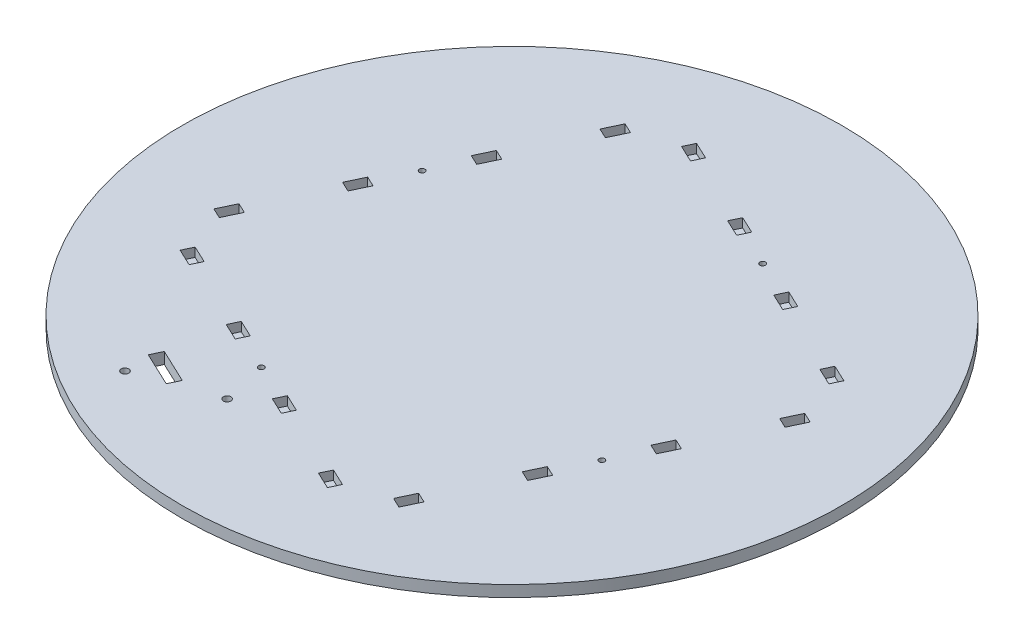
from build123d import *

# Parameters (mm, degrees)
SKETCH1_R           = 175
BOSS_EXTRUDE1_DEPTH = 6
CUT_EXTRUDE1_DEPTH  = 4.75
SKETCH4_R           = 2
CUT_EXTRUDE2_DEPTH  = 248.560093715
SKETCH5_R           = 1.5
CUT_EXTRUDE3_DEPTH  = 248.560093715


with BuildPart() as part:
    # Sketch1 → Boss-Extrude1 (new body)
    with BuildSketch(Plane(origin=(0, 0, 0), x_dir=(1, 0, 0), z_dir=(0, 1, 0))):
        Circle(SKETCH1_R)
    extrude(amount=BOSS_EXTRUDE1_DEPTH)

    # Sketch2 → Cut-Extrude1 (cut)
    with BuildSketch(Plane(origin=(0, 6, 0), x_dir=(1, 0, 0), z_dir=(0, 1, 0))):
        Polygon((32.707843252, -122.732216593), (23.666085268, -118.460611209), (21.103122038, -123.885666), (30.144880022, -128.157271383), align=None)
        Polygon((-13.706514401, -100.804642291), (-22.748272385, -96.533036908), (-25.311235615, -101.958091698), (-16.269477631, -106.229697082), align=None)
        Polygon((-106.535229707, -56.949493687), (-115.576987692, -52.677888304), (-118.139950922, -58.102943094), (-109.098192937, -62.374548478), align=None)
        Polygon((-100.804642291, 13.706514401), (-96.533036908, 22.748272385), (-101.958091698, 25.311235615), (-106.229697082, 16.269477631), align=None)
        Polygon((-122.732216593, -32.707843252), (-118.460611209, -23.666085268), (-123.885666, -21.103122038), (-128.157271383, -30.144880022), align=None)
        Polygon((106.535229707, 56.949493687), (115.576987692, 52.677888304), (118.139950922, 58.102943094), (109.098192937, 62.374548478), align=None)
        Polygon((-56.949493687, 106.535229707), (-52.677888304, 115.576987692), (-58.102943094, 118.139950922), (-62.374548478, 109.098192937), align=None)
        Polygon((60.120872054, 78.877067989), (69.162630038, 74.605462606), (71.725593269, 80.030517396), (62.683835284, 84.30212278), align=None)
        Polygon((13.706514401, 100.804642291), (22.748272385, 96.533036908), (25.311235615, 101.958091698), (16.269477631, 106.229697082), align=None)
        Polygon((-32.707843252, 122.732216593), (-23.666085268, 118.460611209), (-21.103122038, 123.885666), (-30.144880022, 128.157271383), align=None)
        Polygon((-78.877067989, 60.120872054), (-74.605462606, 69.162630038), (-80.030517396, 71.725593269), (-84.30212278, 62.683835284), align=None)
        Polygon((-60.120872054, -78.877067989), (-69.162630038, -74.605462606), (-71.725593269, -80.030517396), (-62.683835284, -84.30212278), align=None)
        Polygon((122.732216593, 32.707843252), (118.460611209, 23.666085268), (123.885666, 21.103122038), (128.157271383, 30.144880022), align=None)
        Polygon((100.804642291, -13.706514401), (96.533036908, -22.748272385), (101.958091698, -25.311235615), (106.229697082, -16.269477631), align=None)
        Polygon((78.877067989, -60.120872054), (74.605462606, -69.162630038), (80.030517396, -71.725593269), (84.30212278, -62.683835284), align=None)
        Polygon((56.949493687, -106.535229707), (52.677888304, -115.576987692), (58.102943094, -118.139950922), (62.374548478, -109.098192937), align=None)
    extrude(amount=-CUT_EXTRUDE1_DEPTH, mode=Mode.SUBTRACT)

    # Sketch4 → Cut-Extrude2 (cut, through all)
    with BuildSketch(Plane(origin=(0, 6, 0), x_dir=(1, 0, 0), z_dir=(0, 1, 0))):
        with Locations((-77.20955719, -128.314785892)):
            Circle(SKETCH4_R)
        with Locations((-37.269467087, -114.004328089)):
            Circle(SKETCH4_R)
        Polygon((-57.680950013, -117.411873359), (-75.764465982, -108.868662592), (-78.498293427, -114.655387702), (-60.414777458, -123.198598469), align=None)
    extrude(amount=-CUT_EXTRUDE2_DEPTH, mode=Mode.SUBTRACT)

    # Sketch5 → Cut-Extrude3 (cut, through all)
    with BuildSketch(Plane(origin=(0, 6, 0), x_dir=(1, 0, 0), z_dir=(0, 1, 0))):
        with Locations((42.716053835, 90.417579844)):
            Circle(SKETCH5_R)
        with Locations((90.417579844, -42.716053835)):
            Circle(SKETCH5_R)
        with Locations((-42.716053835, -90.417579844)):
            Circle(SKETCH5_R)
        with Locations((-90.417579844, 42.716053835)):
            Circle(SKETCH5_R)
    extrude(amount=-CUT_EXTRUDE3_DEPTH, mode=Mode.SUBTRACT)


solid = part.part
